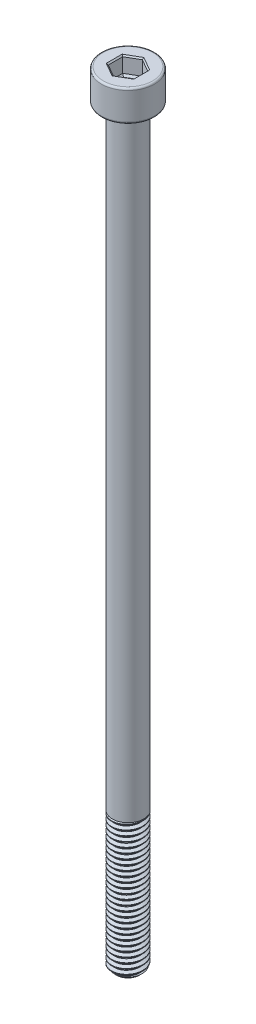
from build123d import *

# Parameters (mm, degrees)
SKETCH1_R           = 2.5
BOSS_EXTRUDE1_DEPTH = 22
THREAD1_PITCH       = 0.8
SKETCH2_R           = 2.5
BOSS_EXTRUDE2_DEPTH = 98
SKETCH3_R           = 4.25
BOSS_EXTRUDE3_DEPTH = 5
FILLET1_R           = 0.3
CUT_EXTRUDE1_DEPTH  = 2.5
CHAMFER1_SIZE       = 0.2
CUT_EXTRUDE2_DEPTH  = 0.3
CUT_EXTRUDE2_DRAFT  = -45


with BuildPart() as part:
    # Sketch1 → Boss-Extrude1 (new body)
    with BuildSketch(Plane(origin=(0, 0, 0), x_dir=(1, 0, 0), z_dir=(0, 1, 0))):
        with Locations(Location((0, 0, 0), (0, 0, 270))):
            Circle(SKETCH1_R)
    extrude(amount=BOSS_EXTRUDE1_DEPTH)

    # Thread1: arcs per turn and ends read off the stored shape
    # Thread1: the profile of Thread Profile1 profile screwed along a right-hand helix through 30 turns, 8 arcs to a turn; built about Z, then put on its axis
    thread1_z = Axis((0, 0, 0), (0, 0, 1))
    thread1_corners = [(2.5003, 0, -0.000173205), (2.5003, 0, 0.700173203), (2.0669873, 0, 0.449999999), (2.0669873, 0, 0.249999999)]
    with BuildLine(mode=Mode.PRIVATE) as thread1_profile:
        Line(thread1_corners[0], thread1_corners[1])
        Line(thread1_corners[1], thread1_corners[2])
        Line(thread1_corners[2], thread1_corners[3])
        Line(thread1_corners[3], thread1_corners[0])
    thread1_cap = Face(thread1_profile.wire())
    thread1_turn_angles = [0, 22.5, 45, 67.5, 90, 112.5, 135, 157.5, 180, 202.5, 225, 247.5, 270, 292.5, 315, 337.5, 360]
    thread1_turn_weights = [1, 0.9238795325112867, 1, 0.9238795325112867, 1, 0.9238795325112867, 1, 0.9238795325112867, 1, 0.9238795325112867, 1, 0.9238795325112867, 1, 0.9238795325112867, 1, 0.9238795325112867, 1]
    thread1_turn_rails = [Edge.make_bspline([Vector(p[0], p[1], 0).rotate(thread1_z, thread1_turn_angles[k]) / thread1_turn_weights[k] + Vector(0, 0, p[2] + THREAD1_PITCH * thread1_turn_angles[k] / 360) for k in range(17)], [0, 0, 0, 1, 1, 2, 2, 3, 3, 4, 4, 5, 5, 6, 6, 7, 7, 8, 8, 8], 2, thread1_turn_weights) for p in thread1_corners]
    thread1_turn_sides = [Face.make_surface_from_curves(thread1_turn_rails[p[0]], thread1_turn_rails[p[1]]) for p in [(0, 1), (1, 2), (2, 3), (3, 0)]]
    thread1 = Plane(origin=(0, 23, 0), x_dir=(-1, 0, 0), z_dir=(0, -1, 0)) * Solid(Shell([*[p.moved(Location((0, 0, THREAD1_PITCH * i))) for i in range(30) for p in thread1_turn_sides], thread1_cap, thread1_cap.rotate(thread1_z, 10800).moved(Location((0, 0, THREAD1_PITCH * 10800 / 360)))]))
    add(thread1, mode=Mode.SUBTRACT)

    # Sketch2 → Boss-Extrude2 (add)
    with BuildSketch(Plane(origin=(0, 22, 0), x_dir=(1, 0, 0), z_dir=(0, 1, 0))):
        with Locations(Location((0, 0, 0), (0, 0, 90))):
            Circle(SKETCH2_R)
    extrude(amount=BOSS_EXTRUDE2_DEPTH)

    # Sketch3 → Boss-Extrude3 (add)
    with BuildSketch(Plane(origin=(0, 120, 0), x_dir=(1, 0, 0), z_dir=(0, 1, 0))):
        with Locations(Location((0, 0, 0), (0, 0, 270))):
            Circle(SKETCH3_R)
    extrude(amount=BOSS_EXTRUDE3_DEPTH)

    # Fillet1
    fillet1_edges = [part.edges().sort_by_distance(p)[0] for p in [
        (0, 120, -4.25),
        (0, 125, -4.25),
    ]]
    fillet(fillet1_edges, radius=FILLET1_R)

    # Sketch4 → Cut-Revolve1 (revolve, cut)
    with BuildSketch(Plane.XY, mode=Mode.PRIVATE) as cut_revolve1_sk:
        Polygon((2.51, 0), (2.51, 0.7), (1.81, 0), align=None)
    revolve(cut_revolve1_sk.sketch.rotate(Axis((0, 0, 0), (0, 1, 0)), 90), axis=Axis((0, 0, 0), (0, 1, 0)), mode=Mode.SUBTRACT)

    # Sketch5 → Cut-Extrude1 (cut)
    with BuildSketch(Plane(origin=(0, 125, 0), x_dir=(1, 0, 0), z_dir=(0, 1, 0))):
        Polygon((0, 2.309401077), (-2, 1.154700538), (-2, -1.154700538), (0, -2.309401077), (2, -1.154700538), (2, 1.154700538), align=None)
    extrude(amount=-CUT_EXTRUDE1_DEPTH, mode=Mode.SUBTRACT)

    # Chamfer1
    chamfer1_edges = [part.edges().sort_by_distance(p)[0] for p in [
        (1, 125, -1.732050808),
        (-1, 125, -1.732050808),
        (-2, 125, 0),
        (-1, 125, 1.732050808),
        (1, 125, 1.732050808),
        (2, 125, 0),
    ]]
    chamfer(chamfer1_edges, length=CHAMFER1_SIZE)


with BuildPart() as cut_extrude2_tool:
    # Sketch6 → Cut-Extrude2 (with draft: the straight prism first)
    with BuildSketch(Plane(origin=(0, 122.5, 0), x_dir=(1, 0, 0), z_dir=(0, 1, 0))):
        Polygon((0, 2.309401077), (-2, 1.154700538), (-2, -1.154700538), (0, -2.309401077), (2, -1.154700538), (2, 1.154700538), align=None)
    extrude(amount=-CUT_EXTRUDE2_DEPTH)
    # Cut-Extrude2: the draft: its side faces are tilted about the plane it starts from
    cut_extrude2_sides = [cut_extrude2_tool.faces().sort_by_distance(p)[0] for p in [
        (-1, 122.35, -1.732050808),
        (-2, 122.35, 0),
        (-1, 122.35, 1.732050808),
        (1, 122.35, 1.732050808),
        (2, 122.35, 0),
        (1, 122.35, -1.732050808),
    ]]
    draft(cut_extrude2_sides, Plane(origin=(0, 122.5, 0), x_dir=(1, 0, 0), z_dir=(0, 1, 0)), CUT_EXTRUDE2_DRAFT)


with BuildPart() as part_1:
    add(part.part)

    # Cut-Extrude2: cut by cut_extrude2_tool
    add(cut_extrude2_tool.part, mode=Mode.SUBTRACT)


solid = part_1.part
